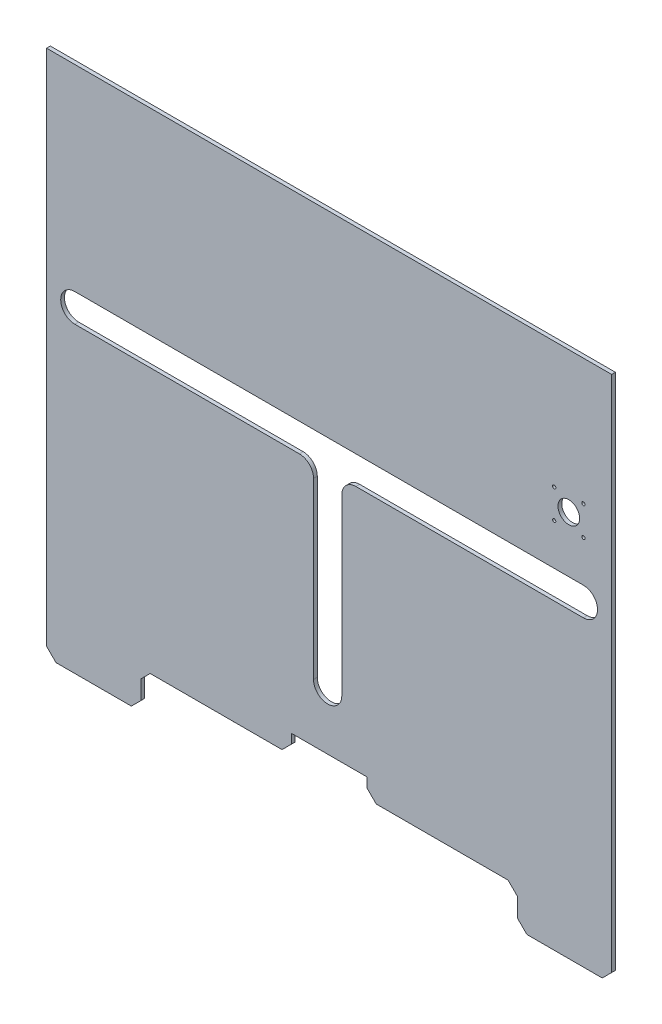
from build123d import *

# Parameters (mm, degrees)
SKETCH1_R           = 1.75
SKETCH1_R_2         = 11.5
BOSS_EXTRUDE1_DEPTH = 4
CUT_EXTRUDE1_DEPTH  = 10
CUT_EXTRUDE2_DEPTH  = 10
FILLET1_R           = 15


with BuildPart() as part:
    # Sketch1 → Boss-Extrude1 (new body)
    with BuildSketch(Plane.XY):
        Polygon((460.319741737, -451.518776284), (460.319741737, -431.518776284), (450.319741737, -421.518776284), (310.319741737, -421.518776284), (300.319741737, -411.518776284), (300.319741737, -401.518776284), (220.319741737, -401.518776284), (220.319741737, -411.518776284), (210.319741737, -421.518776284), (70.319741737, -421.518776284), (60.319741737, -431.518776284), (60.319741737, -451.518776284), (50.319741737, -461.518776284), (2.319741737, -461.518776284), (-29.680258263, -461.518776284), (-39.680258263, -451.518776284), (-39.680258263, -421.518776284), (-39.680258263, -5.004819249), (-39.680258263, 98.481223716), (0.319741737, 98.481223716), (540.319741737, 98.481223716), (560.319741737, 98.481223716), (560.319741737, -5.004819249), (560.319741737, -420.004819249), (560.319741737, -451.518776284), (550.319741737, -461.518776284), (540.319741737, -461.518776284), (470.319741737, -461.518776284), align=None)
        with Locations((499.319741737, -35.448212978)):
            Circle(SKETCH1_R, mode=Mode.SUBTRACT)
        with Locations((499.319741737, -66.448212978)):
            Circle(SKETCH1_R, mode=Mode.SUBTRACT)
        with Locations((530.319741737, -66.448212978)):
            Circle(SKETCH1_R, mode=Mode.SUBTRACT)
        with Locations((530.319741737, -35.448212978)):
            Circle(SKETCH1_R, mode=Mode.SUBTRACT)
        with Locations((514.819741737, -50.948212978)):
            Circle(SKETCH1_R_2, mode=Mode.SUBTRACT)
    extrude(amount=BOSS_EXTRUDE1_DEPTH)

    # Sketch2 → Cut-Extrude1 (cut)
    with BuildSketch(Plane.XY.offset(4)):
        with BuildLine():
            Line((-9.680258263, -110.333406017), (530.319741737, -110.333406017))
            ThreePointArc((530.319741737, -110.333406017), (545.319741737, -125.333406017), (530.319741737, -140.333406017))
            Line((530.319741737, -140.333406017), (-9.680258263, -140.333406017))
            ThreePointArc((-9.680258263, -140.333406017), (-24.680258263, -125.333406017), (-9.680258263, -110.333406017))
        make_face()
    extrude(amount=-CUT_EXTRUDE1_DEPTH, mode=Mode.SUBTRACT)

    # Sketch3 → Cut-Extrude2 (cut)
    with BuildSketch(Plane(origin=(0, 0, 0), x_dir=(-1, 0, 0), z_dir=(0, 0, -1))):
        with BuildLine():
            Line((-273.763542149, -140.333406017), (-273.763542149, -340.333406017))
            ThreePointArc((-273.763542149, -340.333406017), (-258.763542149, -355.333406017), (-243.763542149, -340.333406017))
            Line((-243.763542149, -340.333406017), (-243.763542149, -140.333406017))
            Line((-243.763542149, -140.333406017), (-273.763542149, -140.333406017))
        make_face()
    extrude(amount=-CUT_EXTRUDE2_DEPTH, mode=Mode.SUBTRACT)

    # Fillet1
    fillet1_edges = [part.edges().sort_by_distance(p)[0] for p in [
        (243.763542149, -140.333406017, 2),
        (273.763542149, -140.333406017, 2),
    ]]
    fillet(fillet1_edges, radius=FILLET1_R)


solid = part.part
